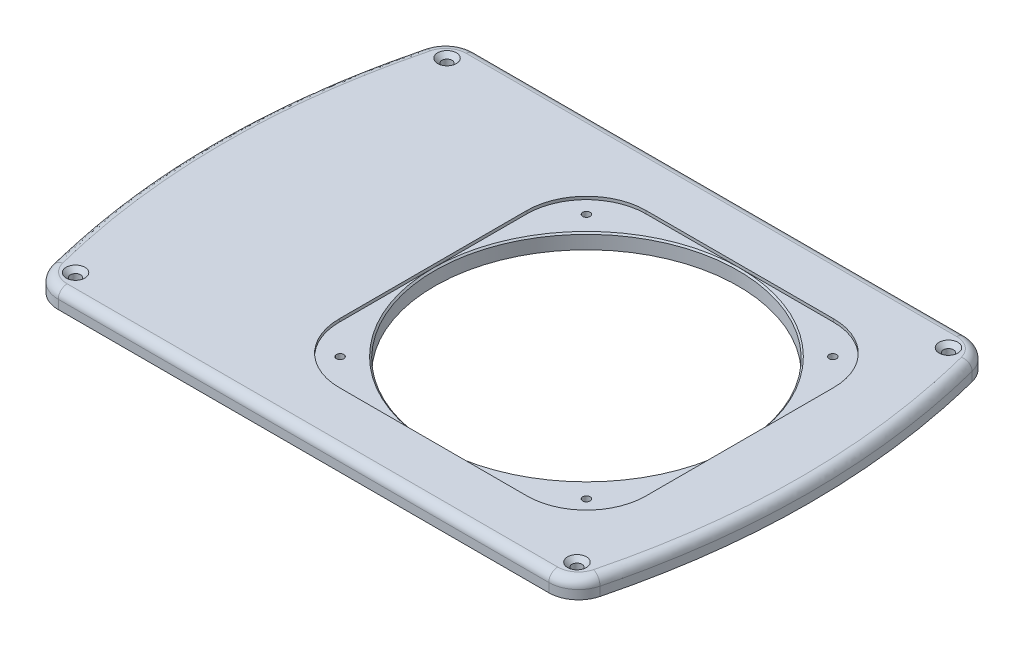
from build123d import *

# Parameters (mm, degrees)
BOSS_EXTRUDE1_DEPTH                             = 6
FILLET1_R                                       = 10
FILLET2_R                                       = 3
CUT_EXTRUDE1_REACH                              = 124.213
SKETCH2_R                                       = 51
M3X0_5_TAPPED_HOLE1_D                           = 2.5
CSK_FOR_M3_FLAT_HEAD_MACHINE_SCREW6_D           = 3.4
CSK_FOR_M3_FLAT_HEAD_MACHINE_SCREW6_CSINK_D     = 6.3
CSK_FOR_M3_FLAT_HEAD_MACHINE_SCREW6_CSINK_ANGLE = 90
SKETCH2_7_W                                     = 103
SKETCH2_7_H                                     = 103
CUT_EXTRUDE3_DEPTH                              = 1
FILLET4_R                                       = 20
CHAMFER1_SIZE                                   = 0.5


with BuildPart() as part:
    # Sketch1 → Boss-Extrude1 (new body)
    with BuildSketch(Plane(origin=(0, 0, 0), x_dir=(1, 0, 0), z_dir=(0, 1, 0))):
        with BuildLine():
            Line((-90, 70), (90, 70))
            add(Edge.make_bspline(
                [(90, 70), (110, 0), (90, -70)],
                knots=[0, 0, 0, 1, 1, 1], degree=2))
            Line((90, -70), (-90, -70))
            add(Edge.make_bspline(
                [(-90, 70), (-110, 0), (-90, -70)],
                knots=[0, 0, 0, 1, 1, 1], degree=2))
        make_face()
    extrude(amount=BOSS_EXTRUDE1_DEPTH)

    # Fillet1
    fillet1_edges = [part.edges().sort_by_distance(p)[0] for p in [
        (-90, 3, -70),
        (90, 3, -70),
        (90, 3, 70),
        (-90, 3, 70),
    ]]
    fillet(fillet1_edges, radius=FILLET1_R)

    # Fillet2
    fillet2_edges = [part.edges().sort_by_distance(p)[0] for p in [
        (-100, 6, -3e-09),
        (0, 6, -70),
        (100, 6, -3e-09),
        (0, 6, 70),
        (-88.48120263, 6, 67.896446056),
        (88.48120263, 6, 67.896446056),
        (88.48120263, 6, -67.896446056),
        (-88.48120263, 6, -67.896446056),
    ]]
    fillet(fillet2_edges, radius=FILLET2_R)

    # Sketch2 → Cut-Extrude1 (cut, up to next)
    with BuildSketch(Plane(origin=(0, 6, 0), x_dir=(1, 0, 0), z_dir=(0, 1, 0)), mode=Mode.PRIVATE) as cut_extrude1_sk1:
        with Locations(Location((25, 0, 0), (0, 0, 270))):
            Circle(SKETCH2_R)
    cut_extrude1_tool1 = extrude(cut_extrude1_sk1.sketch, amount=-CUT_EXTRUDE1_REACH, mode=Mode.PRIVATE) & part.part
    add(cut_extrude1_tool1.solids().sort_by_distance((25, 6, 0))[0], mode=Mode.SUBTRACT)

    # M3x0.5 Tapped Hole1 (through all)
    with Locations(Plane(origin=(0, 6, 0), x_dir=(1, 0, 0), z_dir=(0, 1, 0))):
        with Locations((66.365746699, 41.365746699), (66.365746699, -41.365746699), (-16.365746699, -41.365746699), (-16.365746699, 41.365746699)):
            Hole(M3X0_5_TAPPED_HOLE1_D / 2)

    # CSK for M3 Flat Head Machine Screw6 (through all)
    with Locations(Plane(origin=(0, 6, 0), x_dir=(1, 0, 0), z_dir=(0, 1, 0))):
        with Locations((-84.186251123, 62.368933817), (84.186251123, 62.368933817), (84.186251123, -62.368933817), (-84.186251123, -62.368933817)):
            CounterSinkHole(CSK_FOR_M3_FLAT_HEAD_MACHINE_SCREW6_D / 2, CSK_FOR_M3_FLAT_HEAD_MACHINE_SCREW6_CSINK_D / 2, counter_sink_angle=CSK_FOR_M3_FLAT_HEAD_MACHINE_SCREW6_CSINK_ANGLE)

    # Sketch2<7> → Cut-Extrude3 (cut)
    with BuildSketch(Plane(origin=(0, 6, 0), x_dir=(1, 0, 0), z_dir=(0, 1, 0))):
        with Locations((25, 0)):
            Rectangle(SKETCH2_7_W, SKETCH2_7_H)
    extrude(amount=-CUT_EXTRUDE3_DEPTH, mode=Mode.SUBTRACT)

    # Fillet4
    fillet4_edges = [part.edges().sort_by_distance(p)[0] for p in [
        (76.5, 5.5, 51.5),
        (-26.5, 5.5, 51.5),
        (-26.5, 5.5, -51.5),
        (76.5, 5.5, -51.5),
    ]]
    fillet(fillet4_edges, radius=FILLET4_R)

    # Chamfer1
    chamfer1_edges = [part.edges().sort_by_distance(p)[0] for p in [
        (25, 5, -51),
    ]]
    chamfer(chamfer1_edges, length=CHAMFER1_SIZE - 0.0001)  # a hair under: the kernel refuses the full size


solid = part.part
